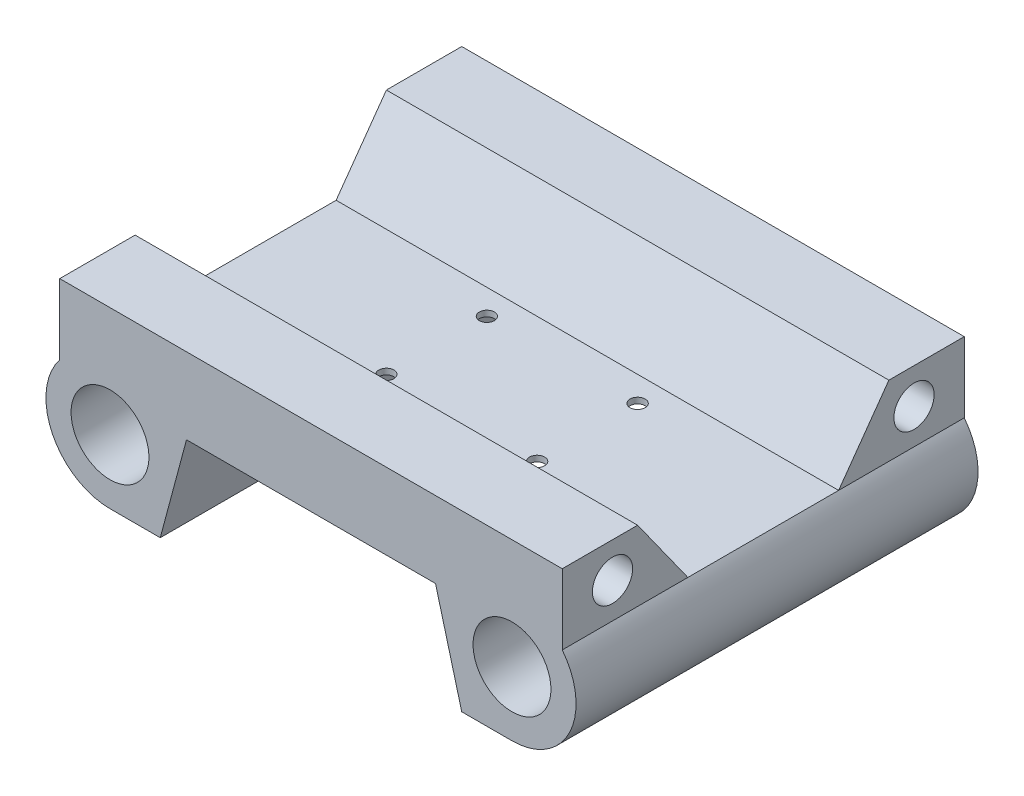
from build123d import *

# Parameters (mm, degrees)
ESBO_O1_R                  = 7.75
RESSALTO_EXTRUS_O1_DEPTH   = 80
ESBO_O2_R                  = 1.5
ESBO_O2_W                  = 15
ESBO_O2_H                  = 15
CORTE_EXTRUS_O1_DEPTH      = 30
CORTE_EXTRUS_O3_DEPTH      = 133.693878359
CORTE_EXTRUS_O3_DEPTH_BACK = 133.693878359
ESBO_O4_R                  = 4


with BuildPart() as part:
    # Esboço1 → Ressalto-extrusão1 (new body)
    with BuildSketch(Plane.XY):
        with BuildLine():
            Line((-40, -25.499042945), (-30, -25.499042945))
            Line((-30, -25.499042945), (-24.77524719, -6))
            Line((-24.77524719, -6), (24.77524719, -6))
            Line((24.77524719, -6), (30, -25.499042945))
            Line((30, -25.499042945), (40, -25.499042945))
            ThreePointArc((40, -25.499042945), (51.475727964, -18.304516116), (50, -4.840646851))
            Line((50, -4.840646851), (50, 9.159353149))
            Line((50, 9.159353149), (-50, 9.159353149))
            Line((-50, 9.159353149), (-50, -4.840646851))
            ThreePointArc((-50, -4.840646851), (-51.475727964, -18.304516116), (-40, -25.499042945))
        make_face()
        with Locations((-40, -12.749521473)):
            Circle(ESBO_O1_R, mode=Mode.SUBTRACT)
        with Locations((40, -12.749521473)):
            Circle(ESBO_O1_R, mode=Mode.SUBTRACT)
    extrude(amount=RESSALTO_EXTRUS_O1_DEPTH)

    # Esboço2 → Corte-extrusão1 (cut)
    with BuildSketch(Plane.XZ.offset(25.499042945)):
        with Locations((15, 50)):
            Circle(ESBO_O2_R)
        with Locations((15, 30)):
            Circle(ESBO_O2_R)
        with Locations((-15, 30)):
            Circle(ESBO_O2_R)
        with Locations((-15, 50)):
            Circle(ESBO_O2_R)
        with Locations((0, 7.5)):
            Rectangle(ESBO_O2_W, ESBO_O2_H)
    extrude(amount=-CORTE_EXTRUS_O1_DEPTH, mode=Mode.SUBTRACT)

    # Esboço4 → Corte-extrusão3 (cut, two sides: drawn at the far end of the back side and taken through both)
    with BuildSketch(Plane.ZY.offset(50).offset(-CORTE_EXTRUS_O3_DEPTH_BACK)):
        with Locations((10, 2.159353149)):
            Circle(ESBO_O4_R)
        with Locations((70, 2.159353149)):
            Circle(ESBO_O4_R)
        Polygon((15, 9.159353149), (25, -4.840646851), (55, -4.840646851), (65, 9.159353149), align=None)
    extrude(amount=CORTE_EXTRUS_O3_DEPTH + CORTE_EXTRUS_O3_DEPTH_BACK, mode=Mode.SUBTRACT)


solid = part.part
